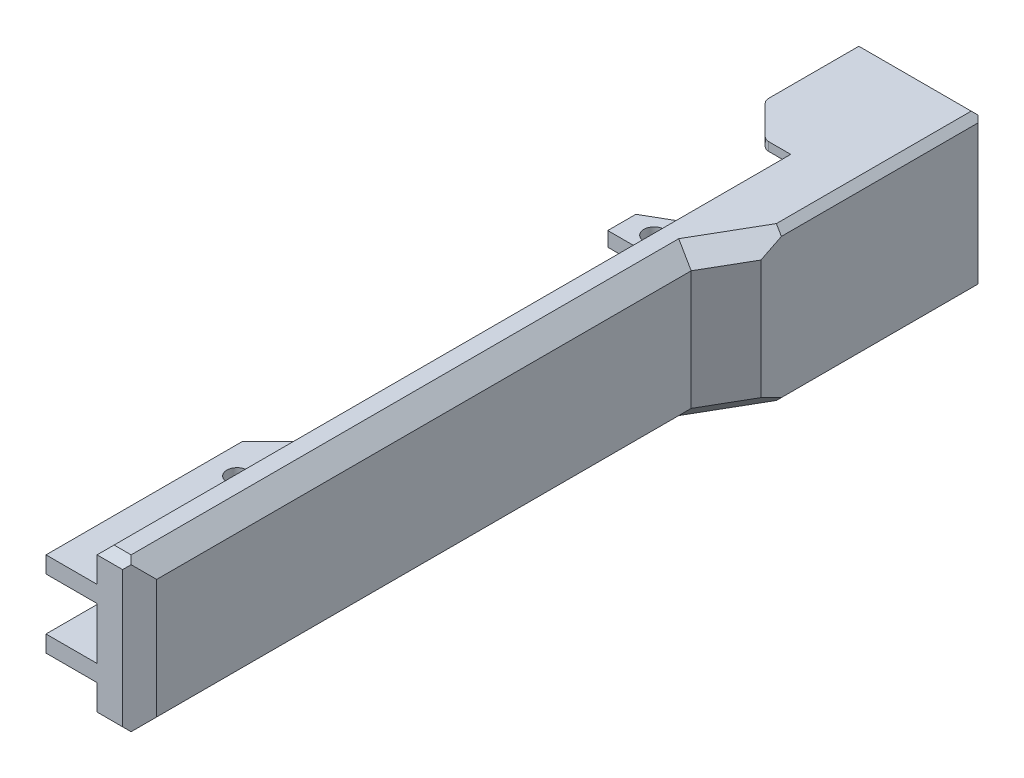
from build123d import *

# Parameters (mm, degrees)
SKETCH_2_W           = 96.5
SKETCH_2_H           = 18
EXTRUDE_1_DEPTH      = 14
SKETCH_6_W           = 6
SKETCH_6_H           = 4
CUT_EXTRUDE_3_DEPTH  = 100.157702676
CUT_EXTRUDE_START    = -4
SKETCH_6_4_W         = 6
SKETCH_6_4_H         = 6.1
CUT_EXTRUDE_5_DEPTH  = 96.157702676
SKETCH_7_W           = 73.4
SKETCH_7_H           = 10
CUT_EXTRUDE_4_DEPTH  = 6
SKETCH_8_R           = 1.2
CUT_EXTRUDE_6_DEPTH  = 99.510151761
SKETCH_10_W          = 2
SKETCH_10_H          = 18
EXTRUDE_3_DEPTH      = 6
CUT_EXTRUDE_7_DEPTH  = 7
CHAMFER_4_SIZE       = 1
SKETCH_12_R          = 3.55
CUT_EXTRUDE_8_DEPTH  = 5
CHAMFER_6_SIZE       = 0.8
CHAMFER_7_SIZE       = 1
EXTRUDE_4_REACH      = 106.158
EXTRUDE_START        = -5
SKETCH_13_W          = 14
SKETCH_13_H          = 1
CHAMFER_8_SIZE       = 6
CHAMFER_9_SIZE       = 4
CHAMFER_10_SIZE      = 3
CHAMFER_10_SIZE2     = 1.732050808
SKETCH_14_W          = 35
SKETCH_14_H          = 6
CUT_EXTRUDE_9_DEPTH  = 2
CHAMFER_11_SIZE      = 4
SKETCH_15_W          = 3
SKETCH_15_H          = 70
CUT_EXTRUDE_10_DEPTH = 100.157702676
CHAMFER_12_SIZE2     = 3
CHAMFER_12_SIZE      = 5.196152423
CHAMFER_14_SIZE      = 2
SKETCH_16_W          = 1
SKETCH_16_H          = 12
EXTRUDE_5_DEPTH      = 0.8
EXTRUDE_START_2      = 16
SKETCH_16_2_W        = 1
SKETCH_16_2_H        = 12
EXTRUDE_6_DEPTH      = 0.8
CHAMFER_15_SIZE      = 0.8
FILLET_1_R           = 1
EXTRUDE_7_DEPTH      = 2
EXTRUDE_START_3      = 6
EXTRUDE_8_DEPTH      = 2
SKETCH_18_R          = 1.2
CUT_EXTRUDE_11_DEPTH = 99.510151761
CHAMFER_16_SIZE      = 0.3


# Some blends are built 0.0001 mm under size
with BuildPart() as part:
    # 草图2 → 凸台-拉伸1 (new body)
    with BuildSketch(Plane(origin=(0, 0, 0), x_dir=(0, 0, -1), z_dir=(1, 0, 0))):
        with Locations((48.25, 9)):
            Rectangle(SKETCH_2_W, SKETCH_2_H)
    extrude(amount=EXTRUDE_1_DEPTH)

    # 草图6 → 切除-拉伸3 (cut, through all)
    with BuildSketch(Plane(origin=(0, 0, -96.5), x_dir=(-1, 0, 0), z_dir=(0, 0, -1))):
        with Locations((-3, 16)):
            Rectangle(SKETCH_6_W, SKETCH_6_H)
        with Locations((-3, 2)):
            Rectangle(SKETCH_6_W, SKETCH_6_H)
    extrude(amount=-CUT_EXTRUDE_3_DEPTH, mode=Mode.SUBTRACT)

    # 草图6<4> → 切除-拉伸5 (cut, through all)
    with BuildSketch(Plane(origin=(0, 0, -96.5), x_dir=(-1, 0, 0), z_dir=(0, 0, -1)).offset(CUT_EXTRUDE_START)):
        with Locations((-3, 9)):
            Rectangle(SKETCH_6_4_W, SKETCH_6_4_H)
    extrude(amount=-CUT_EXTRUDE_5_DEPTH, mode=Mode.SUBTRACT)

    # 草图7 → 切除-拉伸4 (cut)
    with BuildSketch(Plane.ZY):
        with Locations((-59.8, 9)):
            Rectangle(SKETCH_7_W, SKETCH_7_H)
    extrude(amount=-CUT_EXTRUDE_4_DEPTH, mode=Mode.SUBTRACT)

    # 草图8 → 切除-拉伸6 (cut, through all)
    with BuildSketch(Plane(origin=(0, 14, 0), x_dir=(1, 0, 0), z_dir=(0, 1, 0))):
        with Locations(Location((3.2, 19.25, 0), (0, 0, 270))):
            Circle(SKETCH_8_R)
    extrude(amount=-CUT_EXTRUDE_6_DEPTH, mode=Mode.SUBTRACT)

    # 草图10 → 凸台-拉伸3 (add)
    with BuildSketch(Plane.ZY.offset(-6)):
        with Locations((-95.5, 9)):
            Rectangle(SKETCH_10_W, SKETCH_10_H)
    extrude(amount=EXTRUDE_3_DEPTH)

    # 草图11 → 切除-拉伸7 (cut)
    with BuildSketch(Plane.ZY.offset(-6)):
        Polygon((-94.5, 3), (-92.5, 3), (-92.5, 1), (-74.5, 1), (-74.5, 17), (-92.5, 17), (-92.5, 15), (-94.5, 15), align=None)
    extrude(amount=-CUT_EXTRUDE_7_DEPTH, mode=Mode.SUBTRACT)

    # 倒角4
    chamfer_4_edges = [part.edges().sort_by_distance(p)[0] for p in [
        (14, 9, -96.5),
        (6, 18, -47.25),
        (6, 0, -47.25),
        (7, 18, -96.5),
        (7, 0, -96.5),
    ]]
    chamfer(chamfer_4_edges, length=CHAMFER_4_SIZE - 0.0001)  # a hair under: the kernel refuses the full size

    # 草图12 → 切除-拉伸8 (cut)
    with BuildSketch(Plane(origin=(0, 0, -96.5), x_dir=(-1, 0, 0), z_dir=(0, 0, -1))):
        with Locations((-7, 9)):
            Circle(SKETCH_12_R)
    extrude(amount=-CUT_EXTRUDE_8_DEPTH, mode=Mode.SUBTRACT)

    # 倒角6
    chamfer_6_edges = [part.edges().sort_by_distance(p)[0] for p in [
        (14, 18, -47.75005),
        (14, 0, -47.75005),
    ]]
    chamfer(chamfer_6_edges, length=CHAMFER_6_SIZE)

    # 倒角7
    chamfer_7_edges = [part.edges().sort_by_distance(p)[0] for p in [
        (10.09995, 0, 0),
        (10.09995, 18, 0),
    ]]
    chamfer(chamfer_7_edges, length=CHAMFER_7_SIZE)

    # 凸台-拉伸4: up to this face of the body (flat: up to its plane)
    extrude_4_end = Plane(part.part.faces().sort_by_distance((0, 9, -95.480955347))[0])
    # 草图13 → 凸台-拉伸4 (add, up to the picked face)
    with BuildSketch(Plane(origin=(14, 0, 0), x_dir=(0, 0, -1), z_dir=(1, 0, 0)).offset(EXTRUDE_START), mode=Mode.PRIVATE) as extrude_4_sk1:
        with Locations((87.5, 0.5)):
            Rectangle(SKETCH_13_W, SKETCH_13_H)
    extrude_4_tool1 = split(extrude(extrude_4_sk1.sketch, amount=-EXTRUDE_4_REACH, mode=Mode.PRIVATE), bisect_by=extrude_4_end, keep=Keep.BOTH, mode=Mode.PRIVATE)
    # 草图13 → 凸台-拉伸4 (add, up to the picked face)
    with BuildSketch(Plane(origin=(14, 0, 0), x_dir=(0, 0, -1), z_dir=(1, 0, 0)).offset(EXTRUDE_START), mode=Mode.PRIVATE) as extrude_4_sk2:
        with Locations((87.5, 17.5)):
            Rectangle(SKETCH_13_W, SKETCH_13_H)
    extrude_4_tool2 = split(extrude(extrude_4_sk2.sketch, amount=-EXTRUDE_4_REACH, mode=Mode.PRIVATE), bisect_by=extrude_4_end, keep=Keep.BOTH, mode=Mode.PRIVATE)
    add(extrude_4_tool1.solids().sort_by(Axis((9, 0.5, -87.5), (-1, 0, 0)))[0])
    add(extrude_4_tool2.solids().sort_by(Axis((9, 17.5, -87.5), (-1, 0, 0)))[0])

    # 倒角8
    # the kernel refuses this chamfer: 6 mm, written as the material it adds along each edge
    with BuildSketch(Plane(origin=(6, 14, -23.1), x_dir=(0.027495876610585775, 0, -0.9996219169112968), z_dir=(0, -1, 0))) as chamfer_8_piece_1_section:
        Polygon((CHAMFER_8_SIZE * 0.999621916911, -CHAMFER_8_SIZE * 0.0274958766106), (-CHAMFER_8_SIZE * 0.0274958766106, -CHAMFER_8_SIZE * 0.999621916911), (0, 0), align=None)
    chamfer_8_piece_1 = extrude(amount=1.95, mode=Mode.PRIVATE)
    chamfer_8_piece_1 = split(chamfer_8_piece_1, bisect_by=Plane(origin=(1.869207623, 12.869307623, -23.733347392), z_dir=(-0.7071067811865476, 0.7071067811865476, 0)), keep=Keep.TOP, mode=Mode.PRIVATE)
    chamfer_8_piece_1 = split(chamfer_8_piece_1, bisect_by=Plane(origin=(0, 13.288222987, -23.733347392), z_dir=(1, 0, 0)), keep=Keep.TOP, mode=Mode.PRIVATE)
    add(chamfer_8_piece_1)
    with BuildSketch(Plane(origin=(6, 14, -23.1), x_dir=(0.027495876610585775, 0, -0.9996219169112968), z_dir=(0, -1, 0))) as chamfer_8_piece_2_section:
        Polygon((CHAMFER_8_SIZE * 0.999621916911, -CHAMFER_8_SIZE * 0.0274958766106), (-CHAMFER_8_SIZE * 0.0274958766106, -CHAMFER_8_SIZE * 0.999621916911), (0, 0), align=None)
    chamfer_8_piece_2 = extrude(amount=1.95, mode=Mode.PRIVATE)
    chamfer_8_piece_2 = split(chamfer_8_piece_2, bisect_by=Plane(origin=(3.203468607, 14.203568607, -25.288657403), z_dir=(0.7071067811865476, -0.7071067811865476, 0)), keep=Keep.TOP, mode=Mode.PRIVATE)
    add(chamfer_8_piece_2)
    with BuildSketch(Plane(origin=(6, 14, -23.1), x_dir=(0.027495876610585775, 0, -0.9996219169112968), z_dir=(0, -1, 0))) as chamfer_8_piece_3_section:
        Polygon((CHAMFER_8_SIZE * 0.999621916911, -CHAMFER_8_SIZE * 0.0274958766106), (-CHAMFER_8_SIZE * 0.0274958766106, -CHAMFER_8_SIZE * 0.999621916911), (0, 0), align=None)
    chamfer_8_piece_3 = extrude(amount=17.380097928, mode=Mode.PRIVATE)
    chamfer_8_piece_3 = split(chamfer_8_piece_3, bisect_by=Plane(origin=(3.203468607, 3.796431393, -25.288657403), z_dir=(0.7071067811865475, 0.7071067811865476, 0)), keep=Keep.TOP, mode=Mode.PRIVATE)
    chamfer_8_piece_3 = split(chamfer_8_piece_3, bisect_by=Plane(origin=(4.422275915, 5.95, -25.288657403), z_dir=(0, -1, 0)), keep=Keep.TOP, mode=Mode.PRIVATE)
    chamfer_8_piece_3 = split(chamfer_8_piece_3, bisect_by=Plane(origin=(4.422275915, 4, -25.288657403), z_dir=(0, 1, 0)), keep=Keep.TOP, mode=Mode.PRIVATE)
    add(chamfer_8_piece_3)
    with BuildSketch(Plane(origin=(6, 14, -23.1), x_dir=(0.027495876610585775, 0, -0.9996219169112968), z_dir=(0, -1, 0))) as chamfer_8_piece_4_section:
        Polygon((CHAMFER_8_SIZE * 0.999621916911, -CHAMFER_8_SIZE * 0.0274958766106), (-CHAMFER_8_SIZE * 0.0274958766106, -CHAMFER_8_SIZE * 0.999621916911), (0, 0), align=None)
    chamfer_8_piece_4 = extrude(amount=17.380097928, mode=Mode.PRIVATE)
    chamfer_8_piece_4 = split(chamfer_8_piece_4, bisect_by=Plane(origin=(1.869207623, 5.130692377, -23.733347392), z_dir=(-0.7071067811865475, -0.7071067811865476, 0)), keep=Keep.TOP, mode=Mode.PRIVATE)
    chamfer_8_piece_4 = split(chamfer_8_piece_4, bisect_by=Plane(origin=(0, 4.711777013, -23.733347392), z_dir=(1, 0, 0)), keep=Keep.TOP, mode=Mode.PRIVATE)
    chamfer_8_piece_4 = split(chamfer_8_piece_4, bisect_by=Plane(origin=(1.450292259, 5.95, -23.733347392), z_dir=(0, -1, 0)), keep=Keep.TOP, mode=Mode.PRIVATE)
    chamfer_8_piece_4 = split(chamfer_8_piece_4, bisect_by=Plane(origin=(1.450292259, 4, -23.733347392), z_dir=(0, 1, 0)), keep=Keep.TOP, mode=Mode.PRIVATE)
    add(chamfer_8_piece_4)
    with BuildSketch(Plane(origin=(6, 21.380097928, -23.1), x_dir=(0.02749587661058635, 0, -0.9996219169112968), z_dir=(0, -1, 0))) as chamfer_8_piece_5_section:
        Polygon((CHAMFER_8_SIZE * 0.999621916911, -CHAMFER_8_SIZE * 0.0274958766106), (-CHAMFER_8_SIZE * 0.0274958766106, -CHAMFER_8_SIZE * 0.999621916911), (0, 0), align=None)
    chamfer_8_piece_5 = extrude(amount=17.380097928, mode=Mode.PRIVATE)
    chamfer_8_piece_5 = split(chamfer_8_piece_5, bisect_by=Plane(origin=(1.869207623, 12.869307623, -23.733347392), z_dir=(-0.7071067811865476, 0.7071067811865476, 0)), keep=Keep.TOP, mode=Mode.PRIVATE)
    chamfer_8_piece_5 = split(chamfer_8_piece_5, bisect_by=Plane(origin=(1.450292259, 14, -23.733347392), z_dir=(0, -1, 0)), keep=Keep.TOP, mode=Mode.PRIVATE)
    chamfer_8_piece_5 = split(chamfer_8_piece_5, bisect_by=Plane(origin=(0, 13.288222987, -23.733347392), z_dir=(1, 0, 0)), keep=Keep.TOP, mode=Mode.PRIVATE)
    chamfer_8_piece_5 = split(chamfer_8_piece_5, bisect_by=Plane(origin=(1.450292259, 12.05, -23.733347392), z_dir=(0, 1, 0)), keep=Keep.TOP, mode=Mode.PRIVATE)
    add(chamfer_8_piece_5)
    with BuildSketch(Plane(origin=(6, 21.380097928, -23.1), x_dir=(0.02749587661058635, 0, -0.9996219169112968), z_dir=(0, -1, 0))) as chamfer_8_piece_6_section:
        Polygon((CHAMFER_8_SIZE * 0.999621916911, -CHAMFER_8_SIZE * 0.0274958766106), (-CHAMFER_8_SIZE * 0.0274958766106, -CHAMFER_8_SIZE * 0.999621916911), (0, 0), align=None)
    chamfer_8_piece_6 = extrude(amount=17.380097928, mode=Mode.PRIVATE)
    chamfer_8_piece_6 = split(chamfer_8_piece_6, bisect_by=Plane(origin=(3.203468607, 14.203568607, -25.288657403), z_dir=(0.7071067811865476, -0.7071067811865476, 0)), keep=Keep.TOP, mode=Mode.PRIVATE)
    chamfer_8_piece_6 = split(chamfer_8_piece_6, bisect_by=Plane(origin=(4.422275915, 14, -25.288657403), z_dir=(0, -1, 0)), keep=Keep.TOP, mode=Mode.PRIVATE)
    chamfer_8_piece_6 = split(chamfer_8_piece_6, bisect_by=Plane(origin=(4.422275915, 12.05, -25.288657403), z_dir=(0, 1, 0)), keep=Keep.TOP, mode=Mode.PRIVATE)
    add(chamfer_8_piece_6)
    with BuildSketch(Plane(origin=(6, 5.95, -23.1), x_dir=(0.027495876610586095, 0, -0.9996219169112968), z_dir=(0, -1, 0))) as chamfer_8_piece_7_section:
        Polygon((CHAMFER_8_SIZE * 0.999621916911, -CHAMFER_8_SIZE * 0.0274958766106), (-CHAMFER_8_SIZE * 0.0274958766106, -CHAMFER_8_SIZE * 0.999621916911), (0, 0), align=None)
    chamfer_8_piece_7 = extrude(amount=1.95, mode=Mode.PRIVATE)
    chamfer_8_piece_7 = split(chamfer_8_piece_7, bisect_by=Plane(origin=(3.203468607, 3.796431393, -25.288657403), z_dir=(0.7071067811865475, 0.7071067811865476, 0)), keep=Keep.TOP, mode=Mode.PRIVATE)
    add(chamfer_8_piece_7)
    with BuildSketch(Plane(origin=(6, 5.95, -23.1), x_dir=(0.027495876610586095, 0, -0.9996219169112968), z_dir=(0, -1, 0))) as chamfer_8_piece_8_section:
        Polygon((CHAMFER_8_SIZE * 0.999621916911, -CHAMFER_8_SIZE * 0.0274958766106), (-CHAMFER_8_SIZE * 0.0274958766106, -CHAMFER_8_SIZE * 0.999621916911), (0, 0), align=None)
    chamfer_8_piece_8 = extrude(amount=1.95, mode=Mode.PRIVATE)
    chamfer_8_piece_8 = split(chamfer_8_piece_8, bisect_by=Plane(origin=(1.869207623, 5.130692377, -23.733347392), z_dir=(-0.7071067811865475, -0.7071067811865476, 0)), keep=Keep.TOP, mode=Mode.PRIVATE)
    chamfer_8_piece_8 = split(chamfer_8_piece_8, bisect_by=Plane(origin=(0, 4.711777013, -23.733347392), z_dir=(1, 0, 0)), keep=Keep.TOP, mode=Mode.PRIVATE)
    add(chamfer_8_piece_8)

    # 倒角9
    chamfer_9_edges = [part.edges().sort_by_distance(p)[0] for p in [
        (0, 0.5, -80.5),
        (0, 17.5, -80.5),
    ]]
    chamfer(chamfer_9_edges, length=CHAMFER_9_SIZE)

    # 倒角10
    chamfer_10_edges = [part.edges().sort_by_distance(p)[0] for p in [
        (6, 9, -74.5),
    ]]
    chamfer_10_side = [part.faces().sort_by_distance(p)[0] for p in [
        (9.5, 9, -74.5),
    ]]
    chamfer(chamfer_10_edges, length=CHAMFER_10_SIZE, length2=CHAMFER_10_SIZE2, reference=chamfer_10_side[0])

    # 草图14 → 切除-拉伸9 (cut)
    with BuildSketch(Plane.ZY.offset(-6)):
        with Locations((-57, 9)):
            Rectangle(SKETCH_14_W, SKETCH_14_H)
    extrude(amount=-CUT_EXTRUDE_9_DEPTH, mode=Mode.SUBTRACT)

    # 倒角11
    chamfer_11_edges = [part.edges().sort_by_distance(p)[0] for p in [
        (13, 9, -74.5),
    ]]
    chamfer(chamfer_11_edges, length=CHAMFER_11_SIZE - 0.0001)  # a hair under: the kernel refuses the full size

    # 草图15 → 切除-拉伸10 (cut, through all)
    with BuildSketch(Plane.XZ):
        with Locations((12.5, -35)):
            Rectangle(SKETCH_15_W, SKETCH_15_H)
    extrude(amount=-CUT_EXTRUDE_10_DEPTH, mode=Mode.SUBTRACT)

    # 倒角12
    chamfer_12_edges = [part.edges().sort_by_distance(p)[0] for p in [
        (11, 9, -70),
    ]]
    chamfer_12_side = [part.faces().sort_by_distance(p)[0] for p in [
        (11, 9, -69.94),
    ]]
    chamfer(chamfer_12_edges, length=CHAMFER_12_SIZE - 0.0001, length2=CHAMFER_12_SIZE2 - 0.0001, reference=chamfer_12_side[0])  # a hair under: the kernel refuses the full size

    # 倒角13
    # the kernel refuses this chamfer: 2 mm, written as the material it takes off along each edge
    with BuildSketch(Plane(origin=(11, 18, 4.143365976), x_dir=(-0.9996219169112968, 0.027495876610585623, 0), z_dir=(0, 0, -1))) as chamfer_13_piece_1_section:
        with BuildLine():
            Line((2.05734639, 0), (-0.11309431, -2.054235587))
            Line((-0.11309431, -2.054235587), (-0.153079186, -2.053135752))
            ThreePointArc((-0.153079186, -2.053135752), (-0.068258454, -1.026795659), (-0.039984877, 0.001099835))
            Line((-0.039984877, 0.001099835), (0.001099835, 0.039984877))
            ThreePointArc((0.001099835, 0.039984877), (1.028995329, 0.011711299), (2.058446225, 0.039984877))
            Line((2.058446225, 0.039984877), (2.05734639, 0))
        make_face()
    chamfer_13_piece_1 = extrude(amount=74.090679529, mode=Mode.PRIVATE)
    chamfer_13_piece_1 = split(chamfer_13_piece_1, bisect_by=Plane(origin=(-4.335610986, 17.336943865, -38.241515955), z_dir=(0.866028454061691, 0, 0.4999947167276046)), keep=Keep.TOP, mode=Mode.PRIVATE)
    add(chamfer_13_piece_1, mode=Mode.SUBTRACT)
    with BuildSketch(Plane(origin=(11, -4.143365976, 0), x_dir=(0.027495876610586494, 0, -0.9996219169112968), z_dir=(0, 1, 0))) as chamfer_13_piece_2:
        with BuildLine():
            Line((2.05734639, 0), (-0.11309431, 2.054235587))
            Line((-0.11309431, 2.054235587), (-0.153079186, 2.053135752))
            ThreePointArc((-0.153079186, 2.053135752), (-0.068258454, 1.026795659), (-0.039984877, -0.001099835))
            Line((-0.039984877, -0.001099835), (0.001099835, -0.039984877))
            ThreePointArc((0.001099835, -0.039984877), (1.028995329, -0.011711299), (2.058446225, -0.039984877))
            Line((2.058446225, -0.039984877), (2.05734639, 0))
        make_face()
    extrude(amount=26.286731952, mode=Mode.SUBTRACT)
    with BuildSketch(Plane(origin=(11, 0, 4.143365976), x_dir=(0.027495876610586494, 0.9996219169112968, 0), z_dir=(0, 0, -1))) as chamfer_13_piece_3_section:
        with BuildLine():
            Line((2.05734639, 0), (-0.11309431, -2.054235587))
            Line((-0.11309431, -2.054235587), (-0.153079186, -2.053135752))
            ThreePointArc((-0.153079186, -2.053135752), (-0.068258454, -1.026795659), (-0.039984877, 0.001099835))
            Line((-0.039984877, 0.001099835), (0.001099835, 0.039984877))
            ThreePointArc((0.001099835, 0.039984877), (1.028995329, 0.011711299), (2.058446225, 0.039984877))
            Line((2.058446225, 0.039984877), (2.05734639, 0))
        make_face()
    chamfer_13_piece_3 = extrude(amount=74.090679529, mode=Mode.PRIVATE)
    chamfer_13_piece_3 = split(chamfer_13_piece_3, bisect_by=Plane(origin=(-4.335610986, 0.663056135, -38.241515955), z_dir=(0.866028454061691, 0, 0.4999947167276046)), keep=Keep.TOP, mode=Mode.PRIVATE)
    add(chamfer_13_piece_3, mode=Mode.SUBTRACT)
    with BuildSketch(Plane(origin=(8.428344186, 0, -60.349646292), x_dir=(0.023812211514136525, 0.9996219169112968, 0.013747793037086956), z_dir=(0.4999947167276046, 0, -0.866028454061691))) as chamfer_13_piece_4_section:
        with BuildLine():
            Line((2.05734639, 0), (-0.11309431, -2.054235587))
            Line((-0.11309431, -2.054235587), (-0.153079186, -2.053135752))
            ThreePointArc((-0.153079186, -2.053135752), (-0.068258454, -1.026795659), (-0.039984877, 0.001099835))
            Line((-0.039984877, 0.001099835), (0.001099835, 0.039984877))
            ThreePointArc((0.001099835, 0.039984877), (1.028995329, 0.011711299), (2.058446225, 0.039984877))
            Line((2.058446225, 0.039984877), (2.05734639, 0))
        make_face()
    chamfer_13_piece_4 = extrude(amount=14.686778445, mode=Mode.PRIVATE)
    chamfer_13_piece_4 = split(chamfer_13_piece_4, bisect_by=Plane(origin=(11, 0.729642002, -67.930526251), z_dir=(1, 0, 0)), keep=Keep.TOP, mode=Mode.PRIVATE)
    add(chamfer_13_piece_4, mode=Mode.SUBTRACT)
    with BuildSketch(Plane(origin=(8.428344186, 18, -60.349646292), x_dir=(-0.8657010233488743, 0.027495876610585605, -0.4998056771807688), z_dir=(0.4999947167276046, 0, -0.866028454061691))) as chamfer_13_piece_5_section:
        with BuildLine():
            Line((2.05734639, 0), (-0.11309431, -2.054235587))
            Line((-0.11309431, -2.054235587), (-0.153079186, -2.053135752))
            ThreePointArc((-0.153079186, -2.053135752), (-0.068258454, -1.026795659), (-0.039984877, 0.001099835))
            Line((-0.039984877, 0.001099835), (0.001099835, 0.039984877))
            ThreePointArc((0.001099835, 0.039984877), (1.028995329, 0.011711299), (2.058446225, 0.039984877))
            Line((2.058446225, 0.039984877), (2.05734639, 0))
        make_face()
    chamfer_13_piece_5 = extrude(amount=14.686778445, mode=Mode.PRIVATE)
    chamfer_13_piece_5 = split(chamfer_13_piece_5, bisect_by=Plane(origin=(11, 17.270357998, -67.930526251), z_dir=(1, 0, 0)), keep=Keep.TOP, mode=Mode.PRIVATE)
    add(chamfer_13_piece_5, mode=Mode.SUBTRACT)
    with BuildSketch(Plane(origin=(11, 18, 4.143365976), x_dir=(-0.9996219169112968, 0.027495876610585623, 0), z_dir=(0, 0, -1))) as chamfer_13_piece_6a_section:
        with BuildLine():
            Line((2.05734639, 0), (-0.11309431, -2.054235587))
            Line((-0.11309431, -2.054235587), (-0.153079186, -2.053135752))
            ThreePointArc((-0.153079186, -2.053135752), (-0.068258454, -1.026795659), (-0.039984877, 0.001099835))
            Line((-0.039984877, 0.001099835), (0.001099835, 0.039984877))
            ThreePointArc((0.001099835, 0.039984877), (1.028995329, 0.011711299), (2.058446225, 0.039984877))
            Line((2.058446225, 0.039984877), (2.05734639, 0))
        make_face()
    chamfer_13_piece_6a = extrude(amount=74.090679529, mode=Mode.PRIVATE)
    chamfer_13_piece_6a = split(chamfer_13_piece_6a, bisect_by=Plane(origin=(11.657577697, 17.377831414, -65.942921604), z_dir=(-0.866028454061691, 0, -0.4999947167276046)), keep=Keep.TOP, mode=Mode.PRIVATE)
    with BuildSketch(Plane(origin=(8.428344186, 18, -60.349646292), x_dir=(-0.8657010233488743, 0.027495876610585605, -0.4998056771807688), z_dir=(0.4999947167276046, 0, -0.866028454061691))) as chamfer_13_piece_6b_section:
        with BuildLine():
            Line((2.05734639, 0), (-0.11309431, -2.054235587))
            Line((-0.11309431, -2.054235587), (-0.153079186, -2.053135752))
            ThreePointArc((-0.153079186, -2.053135752), (-0.068258454, -1.026795659), (-0.039984877, 0.001099835))
            Line((-0.039984877, 0.001099835), (0.001099835, 0.039984877))
            ThreePointArc((0.001099835, 0.039984877), (1.028995329, 0.011711299), (2.058446225, 0.039984877))
            Line((2.058446225, 0.039984877), (2.05734639, 0))
        make_face()
    chamfer_13_piece_6b = extrude(amount=14.686778445, mode=Mode.PRIVATE)
    chamfer_13_piece_6b = split(chamfer_13_piece_6b, bisect_by=Plane(origin=(11, 17.377831414, -63.488778287), z_dir=(-1, 0, 0)), keep=Keep.TOP, mode=Mode.PRIVATE)
    chamfer_13_piece_6 = chamfer_13_piece_6a & chamfer_13_piece_6b
    add(chamfer_13_piece_6, mode=Mode.SUBTRACT)
    with BuildSketch(Plane(origin=(11, 0, 4.143365976), x_dir=(0.027495876610586494, 0.9996219169112968, 0), z_dir=(0, 0, -1))) as chamfer_13_piece_7a_section:
        with BuildLine():
            Line((2.05734639, 0), (-0.11309431, -2.054235587))
            Line((-0.11309431, -2.054235587), (-0.153079186, -2.053135752))
            ThreePointArc((-0.153079186, -2.053135752), (-0.068258454, -1.026795659), (-0.039984877, 0.001099835))
            Line((-0.039984877, 0.001099835), (0.001099835, 0.039984877))
            ThreePointArc((0.001099835, 0.039984877), (1.028995329, 0.011711299), (2.058446225, 0.039984877))
            Line((2.058446225, 0.039984877), (2.05734639, 0))
        make_face()
    chamfer_13_piece_7a = extrude(amount=74.090679529, mode=Mode.PRIVATE)
    chamfer_13_piece_7a = split(chamfer_13_piece_7a, bisect_by=Plane(origin=(11.657577697, 0.622168586, -65.942921604), z_dir=(-0.866028454061691, 0, -0.4999947167276046)), keep=Keep.TOP, mode=Mode.PRIVATE)
    with BuildSketch(Plane(origin=(8.428344186, 0, -60.349646292), x_dir=(0.023812211514136525, 0.9996219169112968, 0.013747793037086956), z_dir=(0.4999947167276046, 0, -0.866028454061691))) as chamfer_13_piece_7b_section:
        with BuildLine():
            Line((2.05734639, 0), (-0.11309431, -2.054235587))
            Line((-0.11309431, -2.054235587), (-0.153079186, -2.053135752))
            ThreePointArc((-0.153079186, -2.053135752), (-0.068258454, -1.026795659), (-0.039984877, 0.001099835))
            Line((-0.039984877, 0.001099835), (0.001099835, 0.039984877))
            ThreePointArc((0.001099835, 0.039984877), (1.028995329, 0.011711299), (2.058446225, 0.039984877))
            Line((2.058446225, 0.039984877), (2.05734639, 0))
        make_face()
    chamfer_13_piece_7b = extrude(amount=14.686778445, mode=Mode.PRIVATE)
    chamfer_13_piece_7b = split(chamfer_13_piece_7b, bisect_by=Plane(origin=(11, 0.622168586, -63.488778287), z_dir=(-1, 0, 0)), keep=Keep.TOP, mode=Mode.PRIVATE)
    chamfer_13_piece_7 = chamfer_13_piece_7a & chamfer_13_piece_7b
    add(chamfer_13_piece_7, mode=Mode.SUBTRACT)

    # 倒角14
    chamfer_14_edges = [part.edges().sort_by_distance(p)[0] for p in [
        (6, 9, -39.5),
    ]]
    chamfer(chamfer_14_edges, length=CHAMFER_14_SIZE - 0.0001)  # a hair under: the kernel refuses the full size

    # 草图16 → 凸台-拉伸5 (add)
    with BuildSketch(Plane.XZ.offset(-17)):
        with Locations((6.5, -74.5)):
            Rectangle(SKETCH_16_W, SKETCH_16_H)
    extrude(amount=EXTRUDE_5_DEPTH)

    # 草图16<2> → 凸台-拉伸6 (add)
    with BuildSketch(Plane.XZ.offset(-17).offset(EXTRUDE_START_2)):
        with Locations((6.5, -74.5)):
            Rectangle(SKETCH_16_2_W, SKETCH_16_2_H)
    extrude(amount=-EXTRUDE_6_DEPTH)

    # 倒角15
    chamfer_15_edges = [part.edges().sort_by_distance(p)[0] for p in [
        (7, 17, -76.922649731),
        (6.5, 17, -80.5),
        (6.5, 1, -80.5),
        (7, 1, -76.922649731),
    ]]
    chamfer(chamfer_15_edges, length=CHAMFER_15_SIZE - 0.0001)  # a hair under: the kernel refuses the full size

    # 圆角1
    fillet_1_edges = [part.edges().sort_by_distance(p)[0] for p in [
        (0, 0.5, -84.5),
        (0, 17.5, -84.5),
        (4, 17.5, -80.5),
        (4, 0.5, -80.5),
    ]]
    fillet(fillet_1_edges, radius=FILLET_1_R)

    # 草图17 → 凸台-拉伸7 (add)
    with BuildSketch(Plane(origin=(0, 6, 0), x_dir=(1, 0, 0), z_dir=(0, 1, 0))):
        Polygon((6, 72.767949192), (6, 66), (0, 66), (0, 69.303847577), align=None)
    extrude(amount=-EXTRUDE_7_DEPTH)

    # 草图17<2> → 凸台-拉伸8 (add)
    with BuildSketch(Plane(origin=(0, 6, 0), x_dir=(1, 0, 0), z_dir=(0, 1, 0)).offset(EXTRUDE_START_3)):
        Polygon((6, 72.767949192), (6, 66), (0, 66), (0, 69.303847577), align=None)
    extrude(amount=EXTRUDE_8_DEPTH)

    # 草图18 → 切除-拉伸11 (cut, through all)
    with BuildSketch(Plane(origin=(0, 14, 0), x_dir=(1, 0, 0), z_dir=(0, 1, 0))):
        with Locations(Location((3.2, 68.25, 0), (0, 0, 180))):
            Circle(SKETCH_18_R)
    extrude(amount=-CUT_EXTRUDE_11_DEPTH, mode=Mode.SUBTRACT)

    # 倒角16
    chamfer_16_edges = [part.edges().sort_by_distance(p)[0] for p in [
        (4, 6, -71.613248654),
        (4, 12, -71.613248654),
        (3, 6, -66),
        (3, 12, -66),
    ]]
    chamfer(chamfer_16_edges, length=CHAMFER_16_SIZE)


solid = part.part
